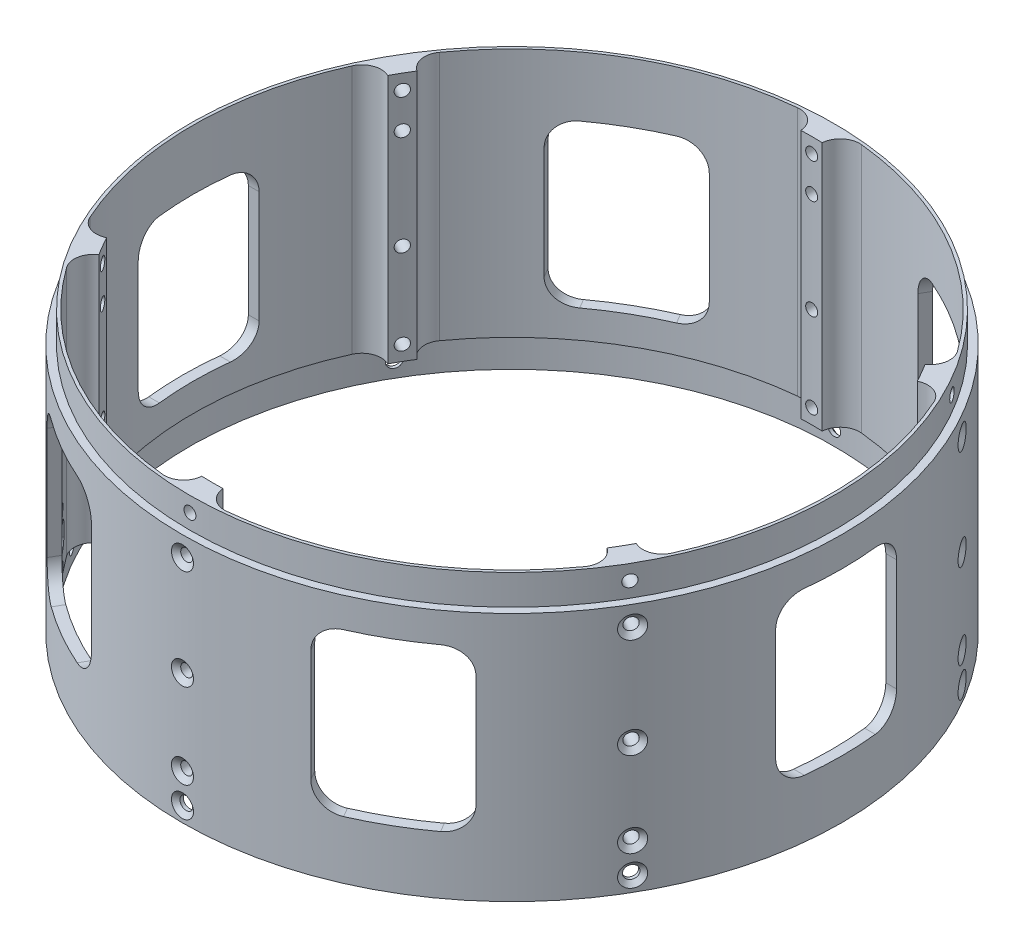
from build123d import *

# Parameters (mm, degrees)
CUT_EXTRUDE1_DEPTH                        = 139.23761861374788
CIRPATTERN1_COUNT                         = 6
TAPPED_HOLE_FOR_4_40_HELICOIL1_AT_2_COUNT = 2
TAPPED_HOLE_FOR_4_40_HELICOIL1_AT_2_PITCH = 55.879999999999995
TAPPED_HOLE_FOR_4_40_HELICOIL1_AT_3_COUNT = 2
TAPPED_HOLE_FOR_4_40_HELICOIL1_AT_3_PITCH = 34.29
TAPPED_HOLE_FOR_4_40_HELICOIL1_AT_4_COUNT = 2
TAPPED_HOLE_FOR_4_40_HELICOIL1_AT_4_PITCH = 8.890000000000004
CIRPATTERN2_COUNT                         = 6
CUT_EXTRUDE2_DEPTH                        = 139.23761878646496
CIRPATTERN5_COUNT                         = 3
SKETCH8_R                                 = 1.5875000000000001
CUT_EXTRUDE3_DEPTH                        = 139.23761878646496


with BuildPart() as part:
    # Sketch1 → Revolve1 (revolve)
    with BuildSketch(Plane.XY):
        Polygon((76.20000000000003, -63.5), (76.20000000000003, 0), (81.88960000000003, 0), (81.88960000000003, -7.6708), (83.82000000000004, -7.670799999999989), (83.82000000000004, -71.12), (81.94040000000005, -71.12), (81.94040000000004, -63.5), align=None)
    revolve(axis=Axis((0, 42.39510168777739, 0), (0, -1, 0)))

    # Sketch2 → Cut-Extrude1 (cut, through all)
    with BuildSketch(Plane(origin=(0, 0, 0), x_dir=(1, 0, 0), z_dir=(0, 1, 0))):
        with BuildLine():
            ThreePointArc((-8.128016987239903, 80.71940796125271), (-40.563800000000136, 70.25856254806241), (-65.8410493792649, 47.39877317396734))
            ThreePointArc((-65.8410493792649, 47.39877317396734), (-64.72088607812911, 40.52071256804154), (-57.842825472203295, 41.64087586917733))
            ThreePointArc((-57.842825472203295, 41.64087586917733), (-35.63620000000011, 61.72370898868599), (-7.140643602440563, 70.9137942201863))
            ThreePointArc((-7.140643602440563, 70.9137942201863), (-2.7315234243070465, 76.3102877831192), (-8.128016987239903, 80.71940796125271))
        make_face()
    cut_extrude1 = extrude(amount=-CUT_EXTRUDE1_DEPTH, mode=Mode.SUBTRACT)

    # CirPattern1: Cut-Extrude1 ×6 about axis
    cirpattern1_axis = Axis((0, 42.39510168777739, 0), (0, 1, 0))
    for i in range(1, CIRPATTERN1_COUNT):
        add(cut_extrude1.rotate(cirpattern1_axis, i * 360 / CIRPATTERN1_COUNT), mode=Mode.SUBTRACT)

    # Sketch4 → Tapped Hole for #4-40 Helicoil1 (revolve, cut)
    with BuildSketch(Plane(origin=(0, -3.8099999999999996, 83.82), x_dir=(0, -1, 0), z_dir=(1, 0, 0))):
        Polygon((0, 0), (-6.45e-15, 26.315711583397988), (1.5239999999999854, 25.39999999999999), (1.5239999999999967, 1.1189393581749023), (2.8575, 0), align=None)
    tapped_hole_for_4_40_helicoil1 = revolve(axis=Axis((0, -3.8099999999999996, 90.16999999999999), (0, 0, -1)), mode=Mode.SUBTRACT)

    # Tapped Hole for #4-40 Helicoil1 at 2: Tapped Hole for #4-40 Helicoil1 ×2
    with Locations(*[(0, -i * TAPPED_HOLE_FOR_4_40_HELICOIL1_AT_2_PITCH, 0) for i in range(1, TAPPED_HOLE_FOR_4_40_HELICOIL1_AT_2_COUNT)]):
        add(tapped_hole_for_4_40_helicoil1, mode=Mode.SUBTRACT)

    # Tapped Hole for #4-40 Helicoil1 at 3: Tapped Hole for #4-40 Helicoil1 ×2
    with Locations(*[(0, -i * TAPPED_HOLE_FOR_4_40_HELICOIL1_AT_3_PITCH, 0) for i in range(1, TAPPED_HOLE_FOR_4_40_HELICOIL1_AT_3_COUNT)]):
        add(tapped_hole_for_4_40_helicoil1, mode=Mode.SUBTRACT)

    # Tapped Hole for #4-40 Helicoil1 at 4: Tapped Hole for #4-40 Helicoil1 ×2
    with Locations(*[(0, -i * TAPPED_HOLE_FOR_4_40_HELICOIL1_AT_4_PITCH, 0) for i in range(1, TAPPED_HOLE_FOR_4_40_HELICOIL1_AT_4_COUNT)]):
        add(tapped_hole_for_4_40_helicoil1, mode=Mode.SUBTRACT)

    # Sketch6 → CSK for #4 Flat Head Machine Screw (100)1 (revolve, cut)
    with BuildSketch(Plane(origin=(1.24e-15, -67.30999999999997, 83.82), x_dir=(0, -1, 0), z_dir=(1, 0, 0))):
        Polygon((0, 0), (-6.45e-15, 26.380574487222027), (1.6319499999999938, 25.4), (1.631949999999997, 1.0283585529893176), (2.8575, 0), align=None)
    csk_for_4_flat_head_machine_screw_100 = revolve(axis=Axis((1.24e-15, -67.30999999999997, 90.16999999999999), (0, 0, -1)), mode=Mode.SUBTRACT)

    # CirPattern2: Tapped Hole for #4-40 Helicoil1, CSK for #4 Flat Head Machine Screw (100)1 ×6 about axis
    cirpattern2_axis = Axis((0, 42.39510168777739, 0), (0, 1, 0))
    add([tapped_hole_for_4_40_helicoil1.rotate(cirpattern2_axis, i * 360 / CIRPATTERN2_COUNT) for i in range(1, CIRPATTERN2_COUNT)], mode=Mode.SUBTRACT)
    add([csk_for_4_flat_head_machine_screw_100.rotate(cirpattern2_axis, i * 360 / CIRPATTERN2_COUNT) for i in range(1, CIRPATTERN2_COUNT)], mode=Mode.SUBTRACT)

    # CirPattern2 copy 1 sketch → CirPattern2 copy 1 (revolve, cut)
    with BuildSketch(Plane(origin=(72.59024934521163, -59.69, 41.910000000000004), x_dir=(0, -1, 0), z_dir=(0.5000000000000001, 0, -0.8660254037844386))):
        Polygon((0, 0), (-6.45e-15, 26.315711583397988), (1.5239999999999854, 25.39999999999999), (1.5239999999999967, 1.1189393581749023), (2.8575, 0), align=None)
    revolve(axis=Axis((78.08951065924282, -59.69, 45.085), (-0.8660254037844386, 0, -0.5000000000000001)), mode=Mode.SUBTRACT)

    # CirPattern2 copy 2 sketch → CirPattern2 copy 2 (revolve, cut)
    with BuildSketch(Plane(origin=(72.59024934521165, -59.69, -41.909999999999975), x_dir=(0, -1, 0), z_dir=(-0.4999999999999998, 0, -0.8660254037844387))):
        Polygon((0, 0), (-6.45e-15, 26.315711583397988), (1.5239999999999854, 25.39999999999999), (1.5239999999999967, 1.1189393581749023), (2.8575, 0), align=None)
    revolve(axis=Axis((78.08951065924283, -59.69, -45.08499999999997), (-0.8660254037844387, 0, 0.4999999999999998)), mode=Mode.SUBTRACT)

    # CirPattern2 copy 3 sketch → CirPattern2 copy 3 (revolve, cut)
    with BuildSketch(Plane(origin=(1.026e-14, -59.69, -83.82), x_dir=(0, -1, 0), z_dir=(-1, 0, -1.2e-16))):
        Polygon((0, 0), (-6.45e-15, 26.315711583397988), (1.5239999999999854, 25.39999999999999), (1.5239999999999967, 1.1189393581749023), (2.8575, 0), align=None)
    revolve(axis=Axis((1.104e-14, -59.69, -90.16999999999999), (-1.2e-16, 0, 1)), mode=Mode.SUBTRACT)

    # CirPattern2 copy 4 sketch → CirPattern2 copy 4 (revolve, cut)
    with BuildSketch(Plane(origin=(-72.59024934521162, -59.69, -41.91000000000003), x_dir=(0, -1, 0), z_dir=(-0.5000000000000004, 0, 0.8660254037844384))):
        Polygon((0, 0), (-6.45e-15, 26.315711583397988), (1.5239999999999854, 25.39999999999999), (1.5239999999999967, 1.1189393581749023), (2.8575, 0), align=None)
    revolve(axis=Axis((-78.08951065924279, -59.69, -45.085000000000036), (0.8660254037844384, 0, 0.5000000000000004)), mode=Mode.SUBTRACT)

    # CirPattern2 copy 5 sketch → CirPattern2 copy 5 (revolve, cut)
    with BuildSketch(Plane(origin=(-72.59024934521163, -59.69, 41.910000000000004), x_dir=(0, -1, 0), z_dir=(0.5000000000000001, 0, 0.8660254037844386))):
        Polygon((0, 0), (-6.45e-15, 26.315711583397988), (1.5239999999999854, 25.39999999999999), (1.5239999999999967, 1.1189393581749023), (2.8575, 0), align=None)
    revolve(axis=Axis((-78.08951065924282, -59.69, 45.085), (0.8660254037844386, 0, -0.5000000000000001)), mode=Mode.SUBTRACT)

    # CirPattern2 copy 6 sketch → CirPattern2 copy 6 (revolve, cut)
    with BuildSketch(Plane(origin=(72.59024934521163, -38.1, 41.910000000000004), x_dir=(0, -1, 0), z_dir=(0.5000000000000001, 0, -0.8660254037844386))):
        Polygon((0, 0), (-6.45e-15, 26.315711583397988), (1.5239999999999854, 25.39999999999999), (1.5239999999999967, 1.1189393581749023), (2.8575, 0), align=None)
    revolve(axis=Axis((78.08951065924282, -38.1, 45.085), (-0.8660254037844386, 0, -0.5000000000000001)), mode=Mode.SUBTRACT)

    # CirPattern2 copy 7 sketch → CirPattern2 copy 7 (revolve, cut)
    with BuildSketch(Plane(origin=(72.59024934521165, -38.1, -41.909999999999975), x_dir=(0, -1, 0), z_dir=(-0.4999999999999998, 0, -0.8660254037844387))):
        Polygon((0, 0), (-6.45e-15, 26.315711583397988), (1.5239999999999854, 25.39999999999999), (1.5239999999999967, 1.1189393581749023), (2.8575, 0), align=None)
    revolve(axis=Axis((78.08951065924283, -38.1, -45.08499999999997), (-0.8660254037844387, 0, 0.4999999999999998)), mode=Mode.SUBTRACT)

    # CirPattern2 copy 8 sketch → CirPattern2 copy 8 (revolve, cut)
    with BuildSketch(Plane(origin=(1.026e-14, -38.1, -83.82), x_dir=(0, -1, 0), z_dir=(-1, 0, -1.2e-16))):
        Polygon((0, 0), (-6.45e-15, 26.315711583397988), (1.5239999999999854, 25.39999999999999), (1.5239999999999967, 1.1189393581749023), (2.8575, 0), align=None)
    revolve(axis=Axis((1.104e-14, -38.1, -90.16999999999999), (-1.2e-16, 0, 1)), mode=Mode.SUBTRACT)

    # CirPattern2 copy 9 sketch → CirPattern2 copy 9 (revolve, cut)
    with BuildSketch(Plane(origin=(-72.59024934521162, -38.1, -41.91000000000003), x_dir=(0, -1, 0), z_dir=(-0.5000000000000004, 0, 0.8660254037844384))):
        Polygon((0, 0), (-6.45e-15, 26.315711583397988), (1.5239999999999854, 25.39999999999999), (1.5239999999999967, 1.1189393581749023), (2.8575, 0), align=None)
    revolve(axis=Axis((-78.08951065924279, -38.1, -45.085000000000036), (0.8660254037844384, 0, 0.5000000000000004)), mode=Mode.SUBTRACT)

    # CirPattern2 copy 10 sketch → CirPattern2 copy 10 (revolve, cut)
    with BuildSketch(Plane(origin=(-72.59024934521163, -38.1, 41.910000000000004), x_dir=(0, -1, 0), z_dir=(0.5000000000000001, 0, 0.8660254037844386))):
        Polygon((0, 0), (-6.45e-15, 26.315711583397988), (1.5239999999999854, 25.39999999999999), (1.5239999999999967, 1.1189393581749023), (2.8575, 0), align=None)
    revolve(axis=Axis((-78.08951065924282, -38.1, 45.085), (0.8660254037844386, 0, -0.5000000000000001)), mode=Mode.SUBTRACT)

    # CirPattern2 copy 11 sketch → CirPattern2 copy 11 (revolve, cut)
    with BuildSketch(Plane(origin=(72.59024934521163, -12.700000000000003, 41.910000000000004), x_dir=(0, -1, 0), z_dir=(0.5000000000000001, 0, -0.8660254037844386))):
        Polygon((0, 0), (-6.45e-15, 26.315711583397988), (1.5239999999999854, 25.39999999999999), (1.5239999999999967, 1.1189393581749023), (2.8575, 0), align=None)
    revolve(axis=Axis((78.08951065924282, -12.700000000000003, 45.085), (-0.8660254037844386, 0, -0.5000000000000001)), mode=Mode.SUBTRACT)

    # CirPattern2 copy 12 sketch → CirPattern2 copy 12 (revolve, cut)
    with BuildSketch(Plane(origin=(72.59024934521165, -12.700000000000003, -41.909999999999975), x_dir=(0, -1, 0), z_dir=(-0.4999999999999998, 0, -0.8660254037844387))):
        Polygon((0, 0), (-6.45e-15, 26.315711583397988), (1.5239999999999854, 25.39999999999999), (1.5239999999999967, 1.1189393581749023), (2.8575, 0), align=None)
    revolve(axis=Axis((78.08951065924283, -12.700000000000003, -45.08499999999997), (-0.8660254037844387, 0, 0.4999999999999998)), mode=Mode.SUBTRACT)

    # CirPattern2 copy 13 sketch → CirPattern2 copy 13 (revolve, cut)
    with BuildSketch(Plane(origin=(1.026e-14, -12.700000000000003, -83.82), x_dir=(0, -1, 0), z_dir=(-1, 0, -1.2e-16))):
        Polygon((0, 0), (-6.45e-15, 26.315711583397988), (1.5239999999999854, 25.39999999999999), (1.5239999999999967, 1.1189393581749023), (2.8575, 0), align=None)
    revolve(axis=Axis((1.104e-14, -12.700000000000003, -90.16999999999999), (-1.2e-16, 0, 1)), mode=Mode.SUBTRACT)

    # CirPattern2 copy 14 sketch → CirPattern2 copy 14 (revolve, cut)
    with BuildSketch(Plane(origin=(-72.59024934521162, -12.700000000000003, -41.91000000000003), x_dir=(0, -1, 0), z_dir=(-0.5000000000000004, 0, 0.8660254037844384))):
        Polygon((0, 0), (-6.45e-15, 26.315711583397988), (1.5239999999999854, 25.39999999999999), (1.5239999999999967, 1.1189393581749023), (2.8575, 0), align=None)
    revolve(axis=Axis((-78.08951065924279, -12.700000000000003, -45.085000000000036), (0.8660254037844384, 0, 0.5000000000000004)), mode=Mode.SUBTRACT)

    # CirPattern2 copy 15 sketch → CirPattern2 copy 15 (revolve, cut)
    with BuildSketch(Plane(origin=(-72.59024934521163, -12.700000000000003, 41.910000000000004), x_dir=(0, -1, 0), z_dir=(0.5000000000000001, 0, 0.8660254037844386))):
        Polygon((0, 0), (-6.45e-15, 26.315711583397988), (1.5239999999999854, 25.39999999999999), (1.5239999999999967, 1.1189393581749023), (2.8575, 0), align=None)
    revolve(axis=Axis((-78.08951065924282, -12.700000000000003, 45.085), (0.8660254037844386, 0, -0.5000000000000001)), mode=Mode.SUBTRACT)

    # Sketch7 → Cut-Extrude2 (cut, symmetric)
    with BuildSketch(Plane(origin=(0, 0, 0), x_dir=(0, 0, -1), z_dir=(1, 0, 0))):
        with BuildLine():
            Line((-9.017000000000001, -15.24), (9.016999999999998, -15.239999999999998))
            ThreePointArc((9.016999999999998, -15.239999999999998), (13.507128060534573, -17.099871939465423), (15.366999999999996, -21.589999999999996))
            Line((15.366999999999996, -21.589999999999996), (15.367, -50.038))
            ThreePointArc((15.367, -50.038), (13.50712806053458, -54.52812806053458), (9.017000000000001, -56.388))
            Line((9.017000000000001, -56.388), (-9.016999999999998, -56.388))
            ThreePointArc((-9.016999999999998, -56.388), (-13.507128060534576, -54.52812806053458), (-15.366999999999999, -50.038))
            Line((-15.366999999999999, -50.038), (-15.367000000000003, -21.589999999999996))
            ThreePointArc((-15.367000000000003, -21.589999999999996), (-13.507128060534574, -17.099871939465423), (-9.017000000000001, -15.24))
        make_face()
    cut_extrude2 = extrude(amount=CUT_EXTRUDE2_DEPTH, both=True, mode=Mode.SUBTRACT)

    # CirPattern5: Cut-Extrude2 ×3 about axis
    cirpattern5_axis = Axis((0, -7.670799999999992, 0), (0, 1, 0))
    for i in range(1, CIRPATTERN5_COUNT):
        add(cut_extrude2.rotate(cirpattern5_axis, i * 360 / CIRPATTERN5_COUNT), mode=Mode.SUBTRACT)

    # Sketch8 → Cut-Extrude3 (cut, through all)
    with BuildSketch(Plane(origin=(0, 0, 0), x_dir=(0.7071067811865477, 0, 0.7071067811865475), z_dir=(-0.7071067811865475, 0, 0.7071067811865477))):
        with Locations((-6.349999999999993, -48.89500000000002)):
            Circle(SKETCH8_R)
        with Locations((-6.349999999999993, -61.59500000000001)):
            Circle(SKETCH8_R)
        with BuildLine():
            Line((-9.016999999999998, -17.145), (-6.857999999999997, -17.145000000000003))
            ThreePointArc((-6.857999999999997, -17.145000000000003), (-4.612935969732709, -18.074935969732714), (-3.682999999999997, -20.32))
            Line((-3.682999999999997, -20.32), (-3.6829999999999954, -31.115000000000002))
            ThreePointArc((-3.6829999999999954, -31.115000000000002), (-4.612935969732707, -33.36006403026729), (-6.857999999999996, -34.29))
            Line((-6.857999999999996, -34.29), (-9.016999999999996, -34.29))
            ThreePointArc((-9.016999999999996, -34.29), (-11.262064030267283, -33.36006403026729), (-12.191999999999998, -31.115000000000002))
            Line((-12.191999999999998, -31.115000000000002), (-12.191999999999998, -20.32))
            ThreePointArc((-12.191999999999998, -20.32), (-11.262064030267286, -18.07493596973271), (-9.016999999999998, -17.145))
        make_face()
        with BuildLine():
            Line((-7.9374999999999964, -52.07000000000002), (-4.762499999999994, -52.07000000000002))
            ThreePointArc((-4.762499999999994, -52.07000000000002), (-3.639967984866349, -52.53496798486638), (-3.1749999999999923, -53.65750000000002))
            Line((-3.1749999999999923, -53.65750000000002), (-3.1749999999999914, -56.83250000000002))
            ThreePointArc((-3.1749999999999914, -56.83250000000002), (-3.639967984866347, -57.95503201513366), (-4.762499999999992, -58.420000000000016))
            Line((-4.762499999999992, -58.420000000000016), (-7.937499999999995, -58.420000000000016))
            ThreePointArc((-7.937499999999995, -58.420000000000016), (-9.06003201513364, -57.95503201513366), (-9.524999999999997, -56.83250000000002))
            Line((-9.524999999999997, -56.83250000000002), (-9.524999999999999, -53.65750000000002))
            ThreePointArc((-9.524999999999999, -53.65750000000002), (-9.060032015133638, -52.53496798486638), (-7.9374999999999964, -52.07000000000002))
        make_face()
    extrude(amount=CUT_EXTRUDE3_DEPTH, mode=Mode.SUBTRACT)


solid = part.part
